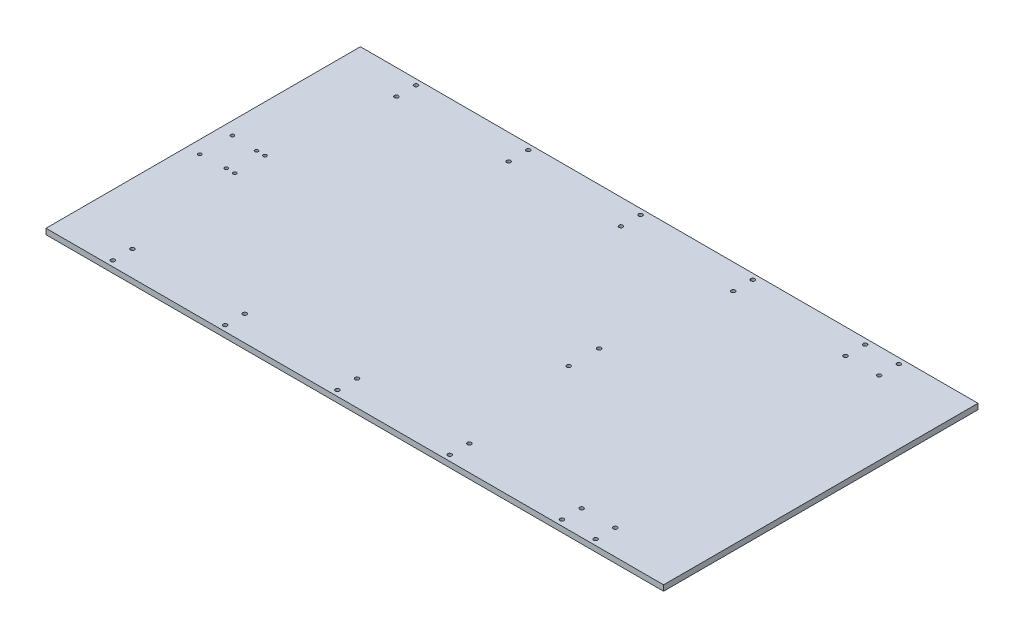
from build123d import *

# Parameters (mm, degrees)
SKETCH_1_W      = 1100
SKETCH_1_H      = 560
SKETCH_1_R      = 3
SKETCH_1_R_2    = 3.5
EXTRUDE_1_DEPTH = 10


with BuildPart() as part:
    # Эскиз1 → Бобышка-Вытянуть1 (new body)
    with BuildSketch(Plane(origin=(0, 0, 0), x_dir=(1, 0, 0), z_dir=(0, 1, 0))):
        with Locations((273.202614379, 6.290849673)):
            Rectangle(SKETCH_1_W, SKETCH_1_H)
        with Locations((-253.797385621, 35.290849673)):
            Circle(SKETCH_1_R, mode=Mode.SUBTRACT)
        with Locations((-208.797385621, 33.290849673)):
            Circle(SKETCH_1_R, mode=Mode.SUBTRACT)
        with Locations((-193.797385621, 33.290849673)):
            Circle(SKETCH_1_R, mode=Mode.SUBTRACT)
        with Locations((-167.797385621, 276.290849673)):
            Circle(SKETCH_1_R_2, mode=Mode.SUBTRACT)
        with Locations((32.202614379, 276.290849673)):
            Circle(SKETCH_1_R_2, mode=Mode.SUBTRACT)
        with Locations((232.202614379, 276.290849673)):
            Circle(SKETCH_1_R_2, mode=Mode.SUBTRACT)
        with Locations((432.202614379, 276.290849673)):
            Circle(SKETCH_1_R_2, mode=Mode.SUBTRACT)
        with Locations((632.202614379, 276.290849673)):
            Circle(SKETCH_1_R_2, mode=Mode.SUBTRACT)
        with Locations((692.202614379, 276.290849673)):
            Circle(SKETCH_1_R_2, mode=Mode.SUBTRACT)
        with Locations((692.202614379, 241.290849673)):
            Circle(SKETCH_1_R_2, mode=Mode.SUBTRACT)
        with Locations((632.202614379, 241.290849673)):
            Circle(SKETCH_1_R_2, mode=Mode.SUBTRACT)
        with Locations((432.202614379, 241.290849673)):
            Circle(SKETCH_1_R_2, mode=Mode.SUBTRACT)
        with Locations((232.202614379, 241.290849673)):
            Circle(SKETCH_1_R_2, mode=Mode.SUBTRACT)
        with Locations((32.202614379, 241.290849673)):
            Circle(SKETCH_1_R_2, mode=Mode.SUBTRACT)
        with Locations((-167.797385621, 241.290849673)):
            Circle(SKETCH_1_R_2, mode=Mode.SUBTRACT)
        with Locations((632.202614379, -228.709150327)):
            Circle(SKETCH_1_R_2, mode=Mode.SUBTRACT)
        with Locations((692.202614379, -228.709150327)):
            Circle(SKETCH_1_R_2, mode=Mode.SUBTRACT)
        with Locations((692.202614379, -263.709150327)):
            Circle(SKETCH_1_R_2, mode=Mode.SUBTRACT)
        with Locations((632.202614379, -263.709150327)):
            Circle(SKETCH_1_R_2, mode=Mode.SUBTRACT)
        with Locations((432.202614379, -228.709150327)):
            Circle(SKETCH_1_R_2, mode=Mode.SUBTRACT)
        with Locations((432.202614379, -263.709150327)):
            Circle(SKETCH_1_R_2, mode=Mode.SUBTRACT)
        with Locations((232.202614379, -228.709150327)):
            Circle(SKETCH_1_R_2, mode=Mode.SUBTRACT)
        with Locations((232.202614379, -263.709150327)):
            Circle(SKETCH_1_R_2, mode=Mode.SUBTRACT)
        with Locations((32.202614379, -228.709150327)):
            Circle(SKETCH_1_R_2, mode=Mode.SUBTRACT)
        with Locations((32.202614379, -263.709150327)):
            Circle(SKETCH_1_R_2, mode=Mode.SUBTRACT)
        with Locations((-167.797385621, -228.709150327)):
            Circle(SKETCH_1_R_2, mode=Mode.SUBTRACT)
        with Locations((-167.797385621, -263.709150327)):
            Circle(SKETCH_1_R_2, mode=Mode.SUBTRACT)
        with Locations((401.202614379, 33.290849673)):
            Circle(SKETCH_1_R_2, mode=Mode.SUBTRACT)
        with Locations((401.202614379, -20.709150327)):
            Circle(SKETCH_1_R_2, mode=Mode.SUBTRACT)
        with Locations((-193.797385621, -20.709150327)):
            Circle(SKETCH_1_R, mode=Mode.SUBTRACT)
        with Locations((-208.797385621, -20.709150327)):
            Circle(SKETCH_1_R, mode=Mode.SUBTRACT)
        with Locations((-253.797385621, -22.709150327)):
            Circle(SKETCH_1_R, mode=Mode.SUBTRACT)
    extrude(amount=EXTRUDE_1_DEPTH)


solid = part.part
